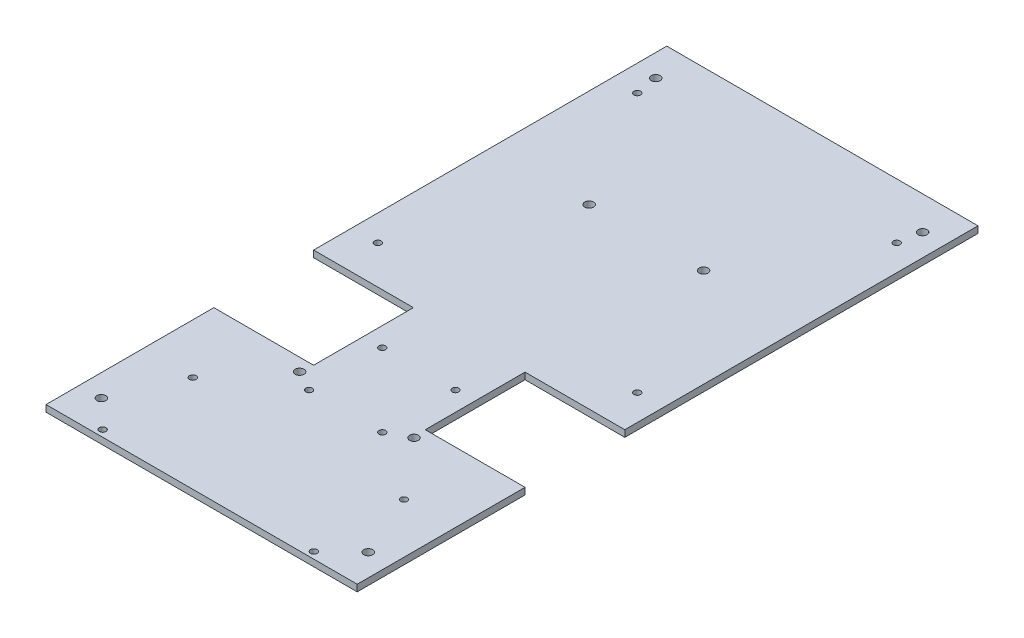
from build123d import *

# Parameters (mm, degrees)
SCHIZZO1_W                   = 140.36
SCHIZZO1_H                   = 280
ESTRUSIONE_ESTRUSIONE1_DEPTH = 3
SCHIZZO2_R                   = 2
TAGLIO_ESTRUSIONE1_DEPTH     = 194.899785911
SCHIZZO3_W                   = 45
SCHIZZO3_H                   = 45
TAGLIO_ESTRUSIONE2_DEPTH     = 194.899785911
SCHIZZO4_R                   = 1.5
SCHIZZO4_R_2                 = 2
TAGLIO_ESTRUSIONE3_DEPTH     = 194.899785911


with BuildPart() as part:
    # Schizzo1 → Estrusione-Estrusione1 (new body)
    with BuildSketch(Plane(origin=(0, 0, 0), x_dir=(1, 0, 0), z_dir=(0, 1, 0))):
        with Locations((-26.670393701, -27.952755906)):
            Rectangle(SCHIZZO1_W, SCHIZZO1_H)
    extrude(amount=ESTRUSIONE_ESTRUSIONE1_DEPTH)

    # Schizzo2 → Taglio-Estrusione1 (cut, through all)
    with BuildSketch(Plane(origin=(0, 3, 0), x_dir=(1, 0, 0), z_dir=(0, 1, 0))):
        with Locations((-86.850393701, -152.952755906)):
            Circle(SCHIZZO2_R)
        with Locations((33.509606299, -152.952755906)):
            Circle(SCHIZZO2_R)
        with Locations((-86.850393701, 97.047244094)):
            Circle(SCHIZZO2_R)
        with Locations((33.509606299, 97.047244094)):
            Circle(SCHIZZO2_R)
    extrude(amount=-TAGLIO_ESTRUSIONE1_DEPTH, mode=Mode.SUBTRACT)

    # Schizzo3 → Taglio-Estrusione2 (cut, through all)
    with BuildSketch(Plane(origin=(0, 0, 0), x_dir=(1, 0, 0), z_dir=(0, 1, 0))):
        with Locations((-74.350393701, -69.752755906)):
            Rectangle(SCHIZZO3_W, SCHIZZO3_H)
        with Locations((21.009606299, -69.752755906)):
            Rectangle(SCHIZZO3_W, SCHIZZO3_H)
    extrude(amount=TAGLIO_ESTRUSIONE2_DEPTH, mode=Mode.SUBTRACT)

    # Schizzo4 → Taglio-Estrusione3 (cut, through all)
    with BuildSketch(Plane(origin=(0, 0, 0), x_dir=(1, 0, 0), z_dir=(0, 1, 0))):
        with Locations((-85.170393701, 87.047244094)):
            Circle(SCHIZZO4_R)
        with Locations((-85.170393701, -29.952755906)):
            Circle(SCHIZZO4_R)
        with Locations((31.829606299, -29.952755906)):
            Circle(SCHIZZO4_R)
        with Locations((31.829606299, 87.047244094)):
            Circle(SCHIZZO4_R)
        with Locations((-43.180393701, -69.952755906)):
            Circle(SCHIZZO4_R)
        with Locations((-10.160393701, -69.952755906)):
            Circle(SCHIZZO4_R)
        with Locations((-10.160393701, -102.972755906)):
            Circle(SCHIZZO4_R)
        with Locations((-43.180393701, -102.972755906)):
            Circle(SCHIZZO4_R)
        with Locations((-52.470393701, -97.952755906)):
            Circle(SCHIZZO4_R_2)
        with Locations((-0.870393701, -97.952755906)):
            Circle(SCHIZZO4_R_2)
        with Locations((-0.870393701, 32.647244094)):
            Circle(SCHIZZO4_R_2)
        with Locations((-52.470393701, 32.647244094)):
            Circle(SCHIZZO4_R_2)
        with Locations((-74.295393701, -124.312755906)):
            Circle(SCHIZZO4_R)
        with Locations((20.954606299, -124.312755906)):
            Circle(SCHIZZO4_R)
        with Locations((20.954606299, -164.952755906)):
            Circle(SCHIZZO4_R)
        with Locations((-74.295393701, -164.952755906)):
            Circle(SCHIZZO4_R)
    extrude(amount=TAGLIO_ESTRUSIONE3_DEPTH, mode=Mode.SUBTRACT)


solid = part.part
